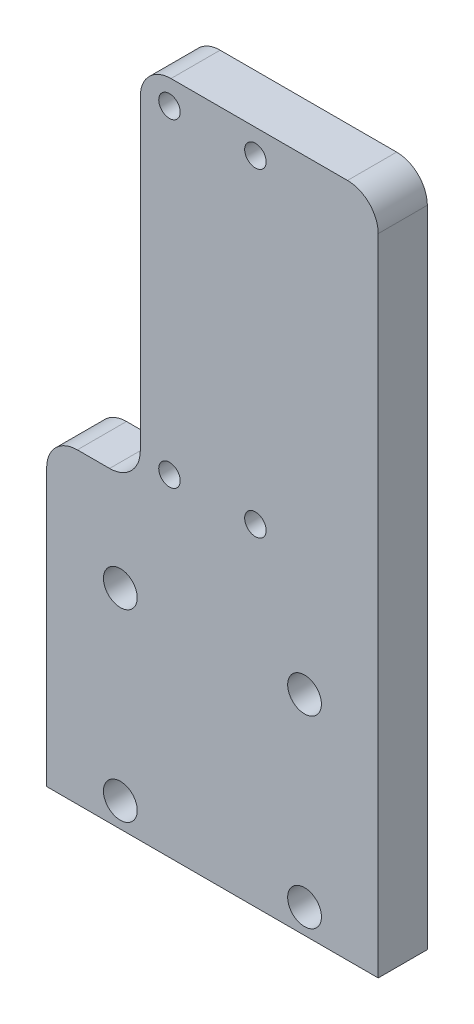
from build123d import *

# Parameters (mm, degrees)
SKETCH_1_R          = 2.75
EXTRUDE_1_DEPTH     = 8
SKETCH_2_W          = 15.25
SKETCH_2_H          = 60
CUT_EXTRUDE_1_DEPTH = 10
FILLET_1_R          = 5
SKETCH_3_R          = 1.75
CUT_EXTRUDE_2_DEPTH = 123.800651464


with BuildPart() as part:
    # 草图1 → 凸台-拉伸1 (new body)
    with BuildSketch(Plane.XY):
        Polygon((0, 0), (54, 0), (54, -52), (54, -110), (0, -110), align=None)
        with Locations((12, -106)):
            Circle(SKETCH_1_R, mode=Mode.SUBTRACT)
        with Locations((42, -106)):
            Circle(SKETCH_1_R, mode=Mode.SUBTRACT)
        with Locations((42, -76)):
            Circle(SKETCH_1_R, mode=Mode.SUBTRACT)
        with Locations((12, -76)):
            Circle(SKETCH_1_R, mode=Mode.SUBTRACT)
    extrude(amount=EXTRUDE_1_DEPTH)

    # 草图2 → 切除-拉伸1 (cut)
    with BuildSketch(Plane(origin=(0, 0, 0), x_dir=(-1, 0, 0), z_dir=(0, 0, -1))):
        with Locations((-7.625, -30)):
            Rectangle(SKETCH_2_W, SKETCH_2_H)
    extrude(amount=-CUT_EXTRUDE_1_DEPTH, mode=Mode.SUBTRACT)

    # 圆角1
    fillet_1_edges = [part.edges().sort_by_distance(p)[0] for p in [
        (15.25, 0, 4),
        (15.25, -60, 4),
        (54, 0, 4),
        (0, -60, 4),
    ]]
    fillet(fillet_1_edges, radius=FILLET_1_R)

    # 草图3 → 切除-拉伸2 (cut, through all)
    with BuildSketch(Plane(origin=(0, 0, 0), x_dir=(-1, 0, 0), z_dir=(0, 0, -1))):
        with Locations((-20, -4)):
            Circle(SKETCH_3_R)
        with Locations((-34, -4)):
            Circle(SKETCH_3_R)
        with Locations((-34, -56)):
            Circle(SKETCH_3_R)
        with Locations((-20, -56)):
            Circle(SKETCH_3_R)
    extrude(amount=-CUT_EXTRUDE_2_DEPTH, mode=Mode.SUBTRACT)


solid = part.part
